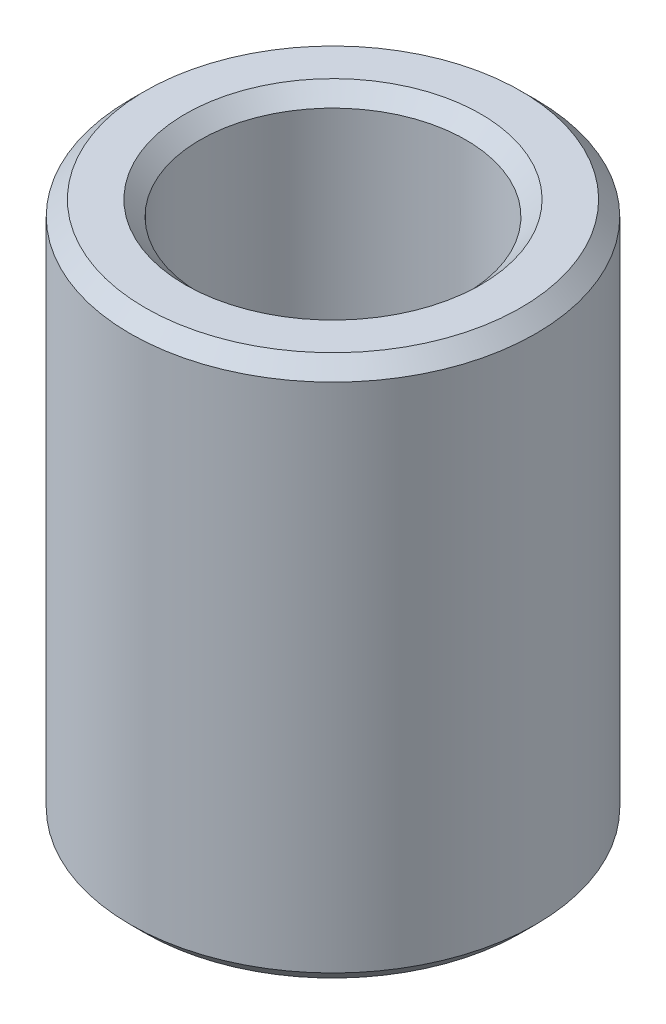
from build123d import *

# Parameters (mm, degrees)
SKETCH1_R           = 37.5
BOSS_EXTRUDE1_DEPTH = 100.153044211
SKETCH2_R           = 24.581669551
CUT_EXTRUDE1_DEPTH  = 114.327544157
CHAMFER1_SIZE       = 2.763931856


with BuildPart() as part:
    # Sketch1 → Boss-Extrude1 (new body)
    with BuildSketch(Plane(origin=(0, 0, 0), x_dir=(1, 0, 0), z_dir=(0, 1, 0))):
        Circle(SKETCH1_R)
    extrude(amount=BOSS_EXTRUDE1_DEPTH)

    # Sketch2 → Cut-Extrude1 (cut, through all)
    with BuildSketch(Plane(origin=(0, 0, 0), x_dir=(1, 0, 0), z_dir=(0, 1, 0))):
        Circle(SKETCH2_R)
    extrude(amount=CUT_EXTRUDE1_DEPTH, mode=Mode.SUBTRACT)

    # Chamfer1
    chamfer1_edges = [part.edges().sort_by_distance(p)[0] for p in [
        (-24.581669551, 100.153044211, 0),
        (-24.581669551, 0, 0),
        (-37.5, 0, 0),
        (-37.5, 100.153044211, 0),
    ]]
    chamfer(chamfer1_edges, length=CHAMFER1_SIZE)


solid = part.part
